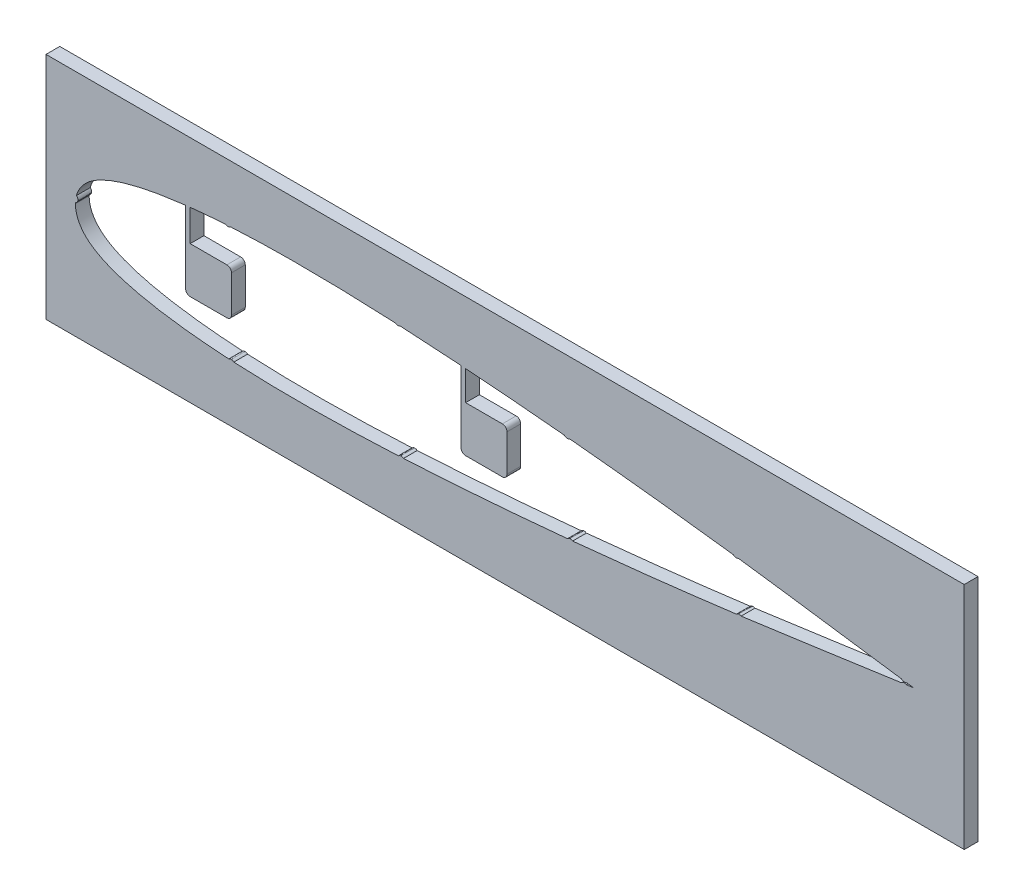
from build123d import *

# Parameters (mm, degrees)
BOSS_EXTRUDE1_OUTLINE_W = 200
BOSS_EXTRUDE1_OUTLINE_H = 50
BOSS_EXTRUDE1_DEPTH     = 3
BOSS_EXTRUDE2_DEPTH     = 3


# Read off the part's stored shape, not the designer's step: Boss-Extrude1
with BuildPart() as part:
    # Boss-Extrude1 outline → Boss-Extrude1 (new body)
    with BuildSketch(Plane.XY):
        with Locations((-60.40087472, 5.874355653)):
            Rectangle(BOSS_EXTRUDE1_OUTLINE_W, BOSS_EXTRUDE1_OUTLINE_H)
        with BuildLine():
            ThreePointArc((-120, 9.874355653), (-120.292893219, 10.581462434), (-121, 10.874355653))
            Line((-121, 10.874355653), (-129, 10.874355653))
            Line((-129, 10.874355653), (-129, 17.728224754))
            add(Edge.make_bspline(
                [(-70, 17.392393963), (-71.039460507, 17.46612011), (-76.013551912, 17.808647867), (-84.935836022, 18.330201475), (-96.791919459, 18.772019121), (-106.707243475, 18.86377853), (-114.665741331, 18.703361206), (-120.648326647, 18.441030965), (-125.42908199, 18.090687531), (-128.216637789, 17.81299496), (-129, 17.728224754)],
                knots=[0.15615159, 0.15615159, 0.15615159, 0.15615159, 0.17648551, 0.25342483, 0.33036415, 0.407303471, 0.445773131, 0.484242791, 0.522712451, 0.53773034, 0.53773034, 0.53773034, 0.53773034], degree=3))
            Line((-70, 17.392393963), (-70, 1.874355653))
            ThreePointArc((-70, 1.874355653), (-69.707106781, 1.167248872), (-69, 0.874355653))
            Line((-69, 0.874355653), (-61, 0.874355653))
            ThreePointArc((-61, 0.874355653), (-60.292893219, 1.167248872), (-60, 1.874355653))
            Line((-60, 1.874355653), (-60, 9.874355653))
            ThreePointArc((-60, 9.874355653), (-60.292893219, 10.581462434), (-61, 10.874355653))
            Line((-61, 10.874355653), (-69, 10.874355653))
            Line((-69, 10.874355653), (-69, 17.307613873))
            add(Edge.make_bspline(
                [(28.535733713, 5.874355653), (22.036609546, 6.792169486), (11.654693654, 8.25451331), (-2.616466314, 10.297391117), (-18.24914202, 12.355943472), (-33.883084779, 14.148766468), (-49.552712035, 15.707085748), (-59.952843917, 16.622838071), (-66.44019909, 17.123046064), (-69, 17.307613873)],
                knots=[0.544251644, 0.544251644, 0.544251644, 0.544251644, 0.673011622, 0.749950942, 0.826890262, 0.980768902, 1.057708222, 1.134647542, 1.184731638, 1.184731638, 1.184731638, 1.184731638], degree=3))
            add(Edge.make_bspline(
                [(-154.013562962, 5.874355653), (-154.012754023, 5.864441531), (-154.006887941, 5.792504528), (-153.995963231, 5.657906898), (-153.975774654, 5.427005754), (-153.93974977, 4.887084814), (-153.673105066, 3.743723501), (-153.279079305, 2.883810187), (-152.881070171, 2.211681144), (-152.43841655, 1.609129761), (-151.979085597, 1.087670791), (-151.364374578, 0.487793016), (-150.623077814, -0.110331018), (-149.465307138, -0.888819845), (-148.078733839, -1.627408488), (-146.46986192, -2.322062574), (-144.893878402, -2.893489486), (-143.338316404, -3.380138223), (-141.282202008, -3.943733592), (-138.735676538, -4.524887858), (-135.698358098, -5.085192271), (-131.665965724, -5.695115565), (-126.648395762, -6.252707907), (-120.64840496, -6.69241361), (-114.665815836, -6.954758154), (-106.70731247, -7.115194365), (-96.791980902, -7.023458271), (-84.93588765, -6.581668259), (-73.114551583, -5.89067806), (-61.322309402, -5.007072053), (-49.552951676, -3.969153072), (-33.883523656, -2.408714089), (-18.249811866, -0.613776043), (-2.617403057, 1.446891386), (11.653995311, 3.491772415), (22.036224825, 4.955590832), (28.535733713, 5.874355653)],
                knots=[-0.002136295, -0.002136295, -0.002136295, -0.002136295, -0.001943991, -0.000741814, 0.000460363, 0.002864716, 0.00526907, 0.007673424, 0.010077778, 0.012482131, 0.014886485, 0.017290839, 0.022099546, 0.026908254, 0.036525669, 0.046143084, 0.055760499, 0.065377914, 0.074995329, 0.094230159, 0.113464989, 0.132699819, 0.171169479, 0.209639139, 0.248108799, 0.286578459, 0.36351778, 0.4404571, 0.51739642, 0.59433574, 0.67127506, 0.74821438, 0.90209302, 0.979032341, 1.055971661, 1.184741624, 1.184741624, 1.184741624, 1.184741624], degree=3))
            add(Edge.make_bspline(
                [(-130, 17.616286621), (-130.890784829, 17.513197686), (-132.787760417, 17.274086814), (-135.698276658, 16.833877019), (-138.735597194, 16.273596559), (-141.282125283, 15.692462458), (-143.338242526, 15.128883439), (-144.893807145, 14.642247117), (-146.469793925, 14.07083284), (-148.078670038, 13.376191734), (-149.465248036, 12.637614381), (-150.62302389, 11.859135098), (-151.364324742, 11.261017247), (-151.979039955, 10.661144675), (-152.438374608, 10.139689647), (-152.88103257, 9.537142135), (-153.279046617, 8.865016669), (-153.67307875, 8.005107026), (-153.939732102, 6.861748632), (-153.97576114, 6.3218284), (-153.995951491, 6.090927588), (-154.006880595, 5.956288759), (-154.012750589, 5.884310868), (-154.013562962, 5.874355653)],
                knots=[-0.002137093, -0.002137093, -0.002137093, -0.002137093, 0.014926792, 0.034161622, 0.053396452, 0.072631282, 0.082248697, 0.091866112, 0.101483527, 0.111100942, 0.120718357, 0.125527064, 0.130335772, 0.132740126, 0.135144479, 0.137548833, 0.139953187, 0.142357541, 0.144761894, 0.147166248, 0.148368425, 0.149570602, 0.149763704, 0.149763704, 0.149763704, 0.149763704], degree=3))
            Line((-130, 17.616286621), (-130, 1.874355653))
            ThreePointArc((-130, 1.874355653), (-129.707106781, 1.167248872), (-129, 0.874355653))
            Line((-129, 0.874355653), (-121, 0.874355653))
            ThreePointArc((-121, 0.874355653), (-120.292893219, 1.167248872), (-120, 1.874355653))
            Line((-120, 1.874355653), (-120, 9.874355653))
        make_face(mode=Mode.SUBTRACT)
    extrude(amount=BOSS_EXTRUDE1_DEPTH)

    # Sketch3 → Boss-Extrude2 (add)
    with BuildSketch(Plane.XY.offset(3)):
        with BuildLine():
            add(Edge.make_bspline(
                [(26.671525209, 7.645516015), (26.616038617, 7.650569387), (26.507123633, 7.660488682), (26.345281059, 7.636193947), (26.191923314, 7.579809713), (26.052060712, 7.491194296), (25.928194971, 7.380786842), (25.830275983, 7.248850247), (25.760462874, 7.098320514), (25.739243735, 6.989196587), (25.728365772, 6.933254354)],
                knots=[0, 0, 0, 0, 1.01487162, 1.992097965, 2.960683225, 3.979797821, 4.998693386, 5.975234306, 6.962006619, 8, 8, 8, 8], degree=3))
            add(Edge.make_bspline(
                [(25.728365772, 6.933254354), (25.723331591, 6.877778616), (25.713449963, 6.768884935), (25.737609394, 6.605954364), (25.795818705, 6.451966665), (25.882541924, 6.309213074), (25.994360079, 6.186667304), (26.122576874, 6.085634112), (26.271561392, 6.017859814), (26.378256471, 5.995469978), (26.432634557, 5.984058802)],
                knots=[0, 0, 0, 0, 1.017250327, 1.996767144, 2.984718075, 4.014456741, 5.035740444, 6.007519375, 6.984514713, 8, 8, 8, 8], degree=3))
            add(Edge.make_bspline(
                [(26.432634557, 5.984058802), (26.488166585, 5.978760002), (26.597449139, 5.968332391), (26.759455372, 5.996378725), (26.91440604, 6.050305144), (27.0550898, 6.140075129), (27.178836377, 6.251279884), (27.274581921, 6.385125695), (27.344491203, 6.533760849), (27.36526677, 6.64165117), (27.375793993, 6.696320463)],
                knots=[0, 0, 0, 0, 1.015281961, 1.997993063, 2.976832369, 3.996359022, 5.026059393, 5.998794247, 6.98596554, 8, 8, 8, 8], degree=3))
            add(Edge.make_bspline(
                [(27.375793993, 6.696320463), (27.381247182, 6.753062322), (27.391889552, 6.863798979), (27.368606008, 7.028829905), (27.310408404, 7.182590437), (27.223877652, 7.324150189), (27.11315868, 7.447298389), (26.981882362, 7.544803299), (26.833398812, 7.614350404), (26.726182522, 7.634992813), (26.671525209, 7.645516015)],
                knots=[0, 0, 0, 0, 1.037794969, 2.025346855, 3.010187337, 4.019462608, 5.037530918, 6.013278971, 6.987198353, 8, 8, 8, 8], degree=3))
        make_face()
        with BuildLine():
            add(Edge.make_bspline(
                [(-9.997383847, 12.743905693), (-10.052966305, 12.74776428), (-10.162069467, 12.755338325), (-10.323351968, 12.72756769), (-10.475461299, 12.667897506), (-10.613385261, 12.576293901), (-10.734847278, 12.463247422), (-10.829905416, 12.329234947), (-10.896464207, 12.177238242), (-10.915330986, 12.067683106), (-10.925003014, 12.011519814)],
                knots=[0, 0, 0, 0, 1.01487162, 1.992097965, 2.960683225, 3.979797821, 4.998693386, 5.975234306, 6.962006619, 8, 8, 8, 8], degree=3))
            add(Edge.make_bspline(
                [(-10.925003014, 12.011519814), (-10.928842649, 11.955948619), (-10.936379493, 11.846867566), (-10.908720726, 11.68449441), (-10.847212335, 11.53179453), (-10.7574383, 11.390939544), (-10.643009844, 11.270827539), (-10.512649315, 11.172575899), (-10.362241326, 11.108022206), (-10.255089292, 11.087932753), (-10.200478315, 11.077693987)],
                knots=[0, 0, 0, 0, 1.017250327, 1.996767144, 2.984718075, 4.014456741, 5.035740444, 6.007519375, 6.984514713, 8, 8, 8, 8], degree=3))
            add(Edge.make_bspline(
                [(-10.200478315, 11.077693987), (-10.144845151, 11.073591005), (-10.035363569, 11.065516669), (-9.873998151, 11.097041557), (-9.720243393, 11.154288761), (-9.5815233, 11.247064331), (-9.460197571, 11.360905363), (-9.367353445, 11.496779858), (-9.300657747, 11.64688449), (-9.282207901, 11.755196764), (-9.272859147, 11.810079866)],
                knots=[0, 0, 0, 0, 1.015281961, 1.997993063, 2.976832369, 3.996359022, 5.026059393, 5.998794247, 6.98596554, 8, 8, 8, 8], degree=3))
            add(Edge.make_bspline(
                [(-9.272859147, 11.810079866), (-9.268627839, 11.866925902), (-9.260370074, 11.97786587), (-9.287198339, 12.142357737), (-9.348690139, 12.294830754), (-9.438246069, 12.434496317), (-9.551588557, 12.555234258), (-9.684932002, 12.649892618), (-9.834877274, 12.716229483), (-9.942512808, 12.734560703), (-9.997383847, 12.743905693)],
                knots=[0, 0, 0, 0, 1.037794969, 2.025346855, 3.010187337, 4.019462608, 5.037530918, 6.013278971, 6.987198353, 8, 8, 8, 8], degree=3))
        make_face()
        with BuildLine():
            add(Edge.make_bspline(
                [(-46.802773528, 16.883535289), (-46.858209225, 16.885056847), (-46.966766327, 16.888036441), (-47.125793078, 16.852475582), (-47.275865471, 16.789589084), (-47.408620348, 16.691576547), (-47.526778382, 16.575738138), (-47.614980862, 16.4373885), (-47.675870174, 16.283145863), (-47.689770224, 16.173294897), (-47.69692181, 16.116776498)],
                knots=[0, 0, 0, 0, 1.012917953, 1.983549283, 2.961176661, 3.974020675, 4.988932927, 5.977529819, 6.959437681, 8, 8, 8, 8], degree=3))
            add(Edge.make_bspline(
                [(-47.69692181, 16.116776498), (-47.699500597, 16.06080095), (-47.704527393, 15.951688532), (-47.667654807, 15.791718382), (-47.605809219, 15.64031551), (-47.508722014, 15.505497232), (-47.392552347, 15.387751432), (-47.255617989, 15.299991769), (-47.104971527, 15.236545824), (-46.996805385, 15.22339679), (-46.941525526, 15.216676787)],
                knots=[0, 0, 0, 0, 1.024721406, 1.99747629, 2.987400565, 4.010946832, 5.028079514, 6.007461816, 6.981684776, 8, 8, 8, 8], degree=3))
            add(Edge.make_bspline(
                [(-46.941525526, 15.216676787), (-46.88628185, 15.214528979), (-46.7773563, 15.210294082), (-46.6171004, 15.243941214), (-46.468685105, 15.31240487), (-46.332897907, 15.407299609), (-46.21591658, 15.52606637), (-46.12675531, 15.664265524), (-46.067006403, 15.817482816), (-46.051640808, 15.925683632), (-46.0438274, 15.980703773)],
                knots=[0, 0, 0, 0, 1.010507111, 1.992446048, 2.967035268, 3.988379424, 5.013529662, 6.002157841, 6.984096778, 8, 8, 8, 8], degree=3))
            add(Edge.make_bspline(
                [(-46.0438274, 15.980703773), (-46.042070909, 16.037401086), (-46.038651061, 16.147789524), (-46.072633806, 16.309858667), (-46.13984369, 16.458887811), (-46.23319649, 16.595164363), (-46.350055293, 16.711724324), (-46.48680422, 16.801034178), (-46.639582154, 16.860304247), (-46.747763359, 16.875704338), (-46.802773528, 16.883535289)],
                knots=[0, 0, 0, 0, 1.036127545, 2.017317846, 3.001172052, 4.012980307, 5.027150879, 6.003681006, 6.984871308, 8, 8, 8, 8], degree=3))
        make_face()
        with BuildLine():
            add(Edge.make_bspline(
                [(-83.712034068, 19.747277512), (-83.768093815, 19.748842259), (-83.87738257, 19.75189274), (-84.035945971, 19.711204852), (-84.185083737, 19.645535299), (-84.317429203, 19.545413069), (-84.432464247, 19.425729247), (-84.52059827, 19.287091401), (-84.578666205, 19.131468856), (-84.59016839, 19.021111945), (-84.596078204, 18.964410651)],
                knots=[0, 0, 0, 0, 1.019817041, 1.98813834, 2.961059037, 3.980219239, 4.997698922, 5.979678029, 6.961960169, 8, 8, 8, 8], degree=3))
            add(Edge.make_bspline(
                [(-84.596078204, 18.964410651), (-84.597544762, 18.908373452), (-84.600420409, 18.798494886), (-84.560707991, 18.639017447), (-84.49406222, 18.489022842), (-84.39470585, 18.355942904), (-84.277628088, 18.237491937), (-84.138856785, 18.150586464), (-83.985485956, 18.092801998), (-83.877282771, 18.079826633), (-83.821985646, 18.073195587)],
                knots=[0, 0, 0, 0, 1.021982574, 2.0039185, 2.978905148, 4.009334003, 5.026920303, 6.010984595, 6.98351574, 8, 8, 8, 8], degree=3))
            add(Edge.make_bspline(
                [(-83.821985646, 18.073195587), (-83.765923504, 18.072709968), (-83.656925414, 18.071765811), (-83.496722984, 18.108562599), (-83.347706514, 18.176762082), (-83.213766078, 18.276841366), (-83.099433306, 18.39784201), (-83.013236409, 18.537873382), (-82.955770908, 18.691767667), (-82.942626203, 18.800581704), (-82.935948355, 18.855862026)],
                knots=[0, 0, 0, 0, 1.022004452, 1.987018837, 2.977257147, 3.997072368, 5.024891971, 6.002104247, 6.985017706, 8, 8, 8, 8], degree=3))
            add(Edge.make_bspline(
                [(-82.935948355, 18.855862026), (-82.935251927, 18.912622136), (-82.933887399, 19.023833534), (-82.972803451, 19.185349942), (-83.03855564, 19.336067384), (-83.137019126, 19.469687592), (-83.256206829, 19.584576987), (-83.395592397, 19.669650695), (-83.54849422, 19.727760629), (-83.65672357, 19.740676745), (-83.712034068, 19.747277512)],
                knots=[0, 0, 0, 0, 1.033670977, 2.025295504, 3.009006503, 4.020254344, 5.03795921, 6.014759962, 6.985445137, 8, 8, 8, 8], degree=3))
        make_face()
        with BuildLine():
            add(Edge.make_bspline(
                [(-120.866940857, 19.893759858), (-120.922297952, 19.888330357), (-121.031029128, 19.877665851), (-121.185377522, 19.821155235), (-121.324629535, 19.735142533), (-121.445637882, 19.621127924), (-121.546725035, 19.489357418), (-121.616071874, 19.339225492), (-121.655460423, 19.177548011), (-121.65496773, 19.065735855), (-121.654716857, 19.0088026)],
                knots=[0, 0, 0, 0, 1.009964173, 1.983749174, 2.963367315, 3.973111684, 4.997045194, 5.969309367, 6.965999486, 8, 8, 8, 8], degree=3))
            add(Edge.make_bspline(
                [(-121.654716857, 19.0088026), (-121.648375267, 18.953575516), (-121.635847051, 18.844470877), (-121.58054595, 18.689059037), (-121.493269035, 18.549105451), (-121.380411035, 18.427181997), (-121.249660262, 18.324390645), (-121.100710202, 18.256686171), (-120.942197618, 18.21565032), (-120.832896713, 18.215958145), (-120.777251689, 18.216114858)],
                knots=[0, 0, 0, 0, 1.01458904, 2.004385593, 2.988132912, 4.012019221, 5.031450495, 6.007812848, 6.985778738, 8, 8, 8, 8], degree=3))
            add(Edge.make_bspline(
                [(-120.777251689, 18.216114858), (-120.721790019, 18.221284114), (-120.612699281, 18.23145182), (-120.459982956, 18.291716016), (-120.31825591, 18.374704395), (-120.196795136, 18.490001733), (-120.098581673, 18.62494142), (-120.028972544, 18.773976093), (-119.988633127, 18.933504366), (-119.990359204, 19.043314535), (-119.991232141, 19.098849385)],
                knots=[0, 0, 0, 0, 1.012746444, 1.992029068, 2.969258287, 3.998834602, 5.02616838, 6.001110967, 6.989091773, 8, 8, 8, 8], degree=3))
            add(Edge.make_bspline(
                [(-119.991232141, 19.098849385), (-119.996720236, 19.155569973), (-120.007438307, 19.266343457), (-120.064995426, 19.422584911), (-120.147871435, 19.564816399), (-120.262293518, 19.685900768), (-120.395587183, 19.784204068), (-120.542625473, 19.856376299), (-120.702475628, 19.893405813), (-120.811380281, 19.893640253), (-120.866940857, 19.893759858)],
                knots=[0, 0, 0, 0, 1.035677954, 2.022645755, 3.009613556, 4.020716163, 5.037671801, 6.017699663, 6.988677293, 8, 8, 8, 8], degree=3))
        make_face()
        with BuildLine():
            add(Edge.make_bspline(
                [(-155.117511996, 7.05504211), (-155.124535032, 6.999759288), (-155.13827439, 6.891607992), (-155.121106236, 6.7290156), (-155.070822335, 6.574121928), (-154.9893637, 6.430218759), (-154.881896475, 6.30368828), (-154.755003874, 6.199313206), (-154.607020847, 6.124461021), (-154.499642476, 6.09916469), (-154.444656152, 6.086210942)],
                knots=[0, 0, 0, 0, 1.017350342, 1.990270291, 2.963727447, 3.97931436, 4.996664702, 5.986102446, 6.968723191, 8, 8, 8, 8], degree=3))
            add(Edge.make_bspline(
                [(-154.444656152, 6.086210942), (-154.389620308, 6.078326293), (-154.280888049, 6.062748887), (-154.117621464, 6.082041059), (-153.961554191, 6.132472558), (-153.817038919, 6.212843497), (-153.688138386, 6.316978937), (-153.585467579, 6.443279366), (-153.508110098, 6.587798559), (-153.483709446, 6.694231372), (-153.471218998, 6.748713261)],
                knots=[0, 0, 0, 0, 1.016375712, 2.008015472, 2.983713517, 4.009494872, 5.024467005, 6.004538507, 6.978543298, 8, 8, 8, 8], degree=3))
            add(Edge.make_bspline(
                [(-153.471218998, 6.748713261), (-153.463196075, 6.803768186), (-153.447431366, 6.911948822), (-153.468403788, 7.074337725), (-153.517499685, 7.230335972), (-153.601358794, 7.373657979), (-153.708296459, 7.500179791), (-153.834136114, 7.605029425), (-153.981204662, 7.67850932), (-154.087432821, 7.705143343), (-154.14148646, 7.718695926)],
                knots=[0, 0, 0, 0, 1.01571244, 1.995832675, 2.970893993, 3.997612812, 5.016639648, 5.99607157, 6.980311577, 8, 8, 8, 8], degree=3))
            add(Edge.make_bspline(
                [(-154.14148646, 7.718695926), (-154.197381951, 7.725952579), (-154.306714331, 7.740146698), (-154.471162196, 7.72377642), (-154.627807461, 7.674135604), (-154.773736896, 7.594111348), (-154.899597998, 7.486142059), (-155.004145699, 7.361086803), (-155.077583847, 7.214711582), (-155.103992112, 7.109107044), (-155.117511996, 7.05504211)],
                knots=[0, 0, 0, 0, 1.02871531, 2.01218185, 2.994813304, 4.017854305, 5.03482249, 6.01227575, 6.982371565, 8, 8, 8, 8], degree=3))
        make_face()
        with BuildLine():
            add(Edge.make_bspline(
                [(-120.131260617, -8.167997006), (-120.186525487, -8.162408056), (-120.295801819, -8.151356913), (-120.449466767, -8.092618398), (-120.589288509, -8.006800689), (-120.709673812, -7.89306332), (-120.808719106, -7.759143371), (-120.877439263, -7.609216777), (-120.915755435, -7.446749323), (-120.91360945, -7.335525241), (-120.912510617, -7.278573929)],
                knots=[0, 0, 0, 0, 1.007931548, 1.993003185, 2.965074996, 3.980463599, 4.99000819, 5.980470956, 6.965917931, 8, 8, 8, 8], degree=3))
            add(Edge.make_bspline(
                [(-120.912510617, -7.278573929), (-120.906923169, -7.223307572), (-120.895874996, -7.114028302), (-120.837114691, -6.960384916), (-120.751379538, -6.820481478), (-120.637046711, -6.700123716), (-120.504194187, -6.599925736), (-120.356319117, -6.527815524), (-120.195856315, -6.49084141), (-120.086689261, -6.491154755), (-120.03110036, -6.491314313)],
                knots=[0, 0, 0, 0, 1.012287025, 2.001615357, 2.977887688, 3.997663991, 5.018829288, 6.00770508, 6.985504507, 8, 8, 8, 8], degree=3))
            add(Edge.make_bspline(
                [(-120.03110036, -6.491314313), (-119.97585016, -6.496928495), (-119.866602835, -6.508029529), (-119.713260955, -6.566198673), (-119.574258004, -6.653193918), (-119.454423082, -6.76827516), (-119.357417746, -6.903112163), (-119.285822463, -7.050946043), (-119.249556087, -7.211365773), (-119.249751464, -7.321156572), (-119.24985036, -7.37673098)],
                knots=[0, 0, 0, 0, 1.012760298, 2.002551171, 2.968904037, 3.997539403, 5.02180996, 5.994862194, 6.985030201, 8, 8, 8, 8], degree=3))
            add(Edge.make_bspline(
                [(-119.24985036, -7.37673098), (-119.256457081, -7.433214849), (-119.269405988, -7.543920953), (-119.324237098, -7.701894862), (-119.412951271, -7.841810566), (-119.526584894, -7.963365007), (-119.659989356, -8.060950564), (-119.806947573, -8.131564187), (-119.966496939, -8.168504826), (-120.07566911, -8.168168345), (-120.131260617, -8.167997006)],
                knots=[0, 0, 0, 0, 1.034819665, 2.028204768, 3.018002552, 4.034396654, 5.044940958, 6.014312746, 6.988869193, 8, 8, 8, 8], degree=3))
        make_face()
        with BuildLine():
            add(Edge.make_bspline(
                [(-83.040979984, -7.902476043), (-83.096681738, -7.902289035), (-83.205711403, -7.901922988), (-83.363606948, -7.858773968), (-83.510747061, -7.788211072), (-83.641090012, -7.685911045), (-83.751684616, -7.562068978), (-83.835693867, -7.420357245), (-83.886853219, -7.262019175), (-83.897112247, -7.151631156), (-83.902358189, -7.095184377)],
                knots=[0, 0, 0, 0, 1.013689814, 1.984179198, 2.960782924, 3.978282514, 4.989326382, 5.978948029, 6.96653752, 8, 8, 8, 8], degree=3))
            add(Edge.make_bspline(
                [(-83.902358189, -7.095184377), (-83.901252337, -7.039508041), (-83.899075574, -6.92991449), (-83.857185464, -6.771118682), (-83.786083107, -6.623357256), (-83.683265738, -6.492980976), (-83.560406434, -6.381084038), (-83.421016975, -6.295179565), (-83.265754833, -6.240491538), (-83.15693575, -6.230779029), (-83.101076138, -6.225793351)],
                knots=[0, 0, 0, 0, 1.016249921, 2.000390955, 2.978823687, 3.998228874, 5.019317759, 6.006565378, 6.976719151, 8, 8, 8, 8], degree=3))
            add(Edge.make_bspline(
                [(-83.101076138, -6.225793351), (-83.045429392, -6.226967151), (-82.935894084, -6.229277665), (-82.776967432, -6.270115103), (-82.630689429, -6.344890549), (-82.501720923, -6.449003371), (-82.388225412, -6.570503355), (-82.307523181, -6.712921346), (-82.251957321, -6.867552078), (-82.243838478, -6.977177116), (-82.239697933, -7.033085018)],
                knots=[0, 0, 0, 0, 1.01630795, 2.00050518, 2.973481989, 4.000464354, 5.021611544, 5.99642908, 6.978194689, 8, 8, 8, 8], degree=3))
            add(Edge.make_bspline(
                [(-82.239697933, -7.033085018), (-82.240676548, -7.090118823), (-82.242580639, -7.201089386), (-82.285316876, -7.361615206), (-82.355417905, -7.510485495), (-82.458276323, -7.64123425), (-82.581808812, -7.751218773), (-82.72117827, -7.83534903), (-82.876673836, -7.887272887), (-82.985173964, -7.897312343), (-83.040979984, -7.902476043)],
                knots=[0, 0, 0, 0, 1.038440826, 2.020492305, 3.007830572, 4.025071329, 5.035858006, 6.014723707, 6.978891809, 8, 8, 8, 8], degree=3))
        make_face()
        with BuildLine():
            add(Edge.make_bspline(
                [(-46.125707517, -5.086557552), (-46.181241537, -5.088020541), (-46.290702516, -5.090904183), (-46.451547956, -5.058260102), (-46.601539282, -4.991489953), (-46.737921827, -4.896684928), (-46.853966526, -4.77659958), (-46.944102671, -4.638333398), (-47.004455099, -4.482603075), (-47.018144925, -4.371928404), (-47.02514662, -4.315323578)],
                knots=[0, 0, 0, 0, 1.008705381, 1.988220537, 2.956819845, 3.97825502, 4.992362785, 5.976615557, 6.965135178, 8, 8, 8, 8], degree=3))
            add(Edge.make_bspline(
                [(-47.02514662, -4.315323578), (-47.027875547, -4.259021781), (-47.033197964, -4.149212451), (-46.994734013, -3.98923258), (-46.933546464, -3.837247368), (-46.836328997, -3.701214069), (-46.718284381, -3.583432538), (-46.58052777, -3.493465218), (-46.428360488, -3.430282406), (-46.319273535, -3.416743682), (-46.263928671, -3.40987486)],
                knots=[0, 0, 0, 0, 1.02379044, 1.996770059, 2.974622982, 3.999066142, 5.024668667, 6.001609697, 6.986124027, 8, 8, 8, 8], degree=3))
            add(Edge.make_bspline(
                [(-46.263928671, -3.40987486), (-46.208332306, -3.408167608), (-46.098611505, -3.404798304), (-45.93853335, -3.441042134), (-45.787538362, -3.505791936), (-45.654224464, -3.605419084), (-45.535417313, -3.72286933), (-45.446047561, -3.861774327), (-45.385822354, -4.015281283), (-45.370357855, -4.123845834), (-45.362486363, -4.179105629)],
                knots=[0, 0, 0, 0, 1.011882911, 1.99697593, 2.96862643, 3.990374474, 5.016186882, 6.003540155, 6.983793879, 8, 8, 8, 8], degree=3))
            add(Edge.make_bspline(
                [(-45.362486363, -4.179105629), (-45.361029686, -4.235958098), (-45.358174964, -4.347374669), (-45.390313932, -4.511354278), (-45.459415455, -4.662106276), (-45.554260977, -4.798709072), (-45.672295166, -4.915342031), (-45.808632849, -5.005467673), (-45.96175997, -5.065586541), (-46.070443804, -5.079488609), (-46.125707517, -5.086557552)],
                knots=[0, 0, 0, 0, 1.033259584, 2.024929458, 3.009797009, 4.031480901, 5.037131669, 6.011441376, 6.988854832, 8, 8, 8, 8], degree=3))
        make_face()
        with BuildLine():
            add(Edge.make_bspline(
                [(-9.307051299, -0.944767721), (-9.362535055, -0.950049459), (-9.47147685, -0.960420099), (-9.631955956, -0.93102295), (-9.785265504, -0.876786944), (-9.92461071, -0.78860509), (-10.047920655, -0.676737957), (-10.14440323, -0.543747427), (-10.21417993, -0.392619768), (-10.234223967, -0.283725905), (-10.244551299, -0.227620285)],
                knots=[0, 0, 0, 0, 1.014709032, 1.992370952, 2.954272398, 3.974258012, 4.985434026, 5.981978762, 6.960250577, 8, 8, 8, 8], degree=3))
            add(Edge.make_bspline(
                [(-10.244551299, -0.227620285), (-10.249684135, -0.171486145), (-10.259694127, -0.062014046), (-10.232723407, 0.100539236), (-10.17954392, 0.255715589), (-10.089737323, 0.396060604), (-9.979423653, 0.520598967), (-9.847616467, 0.617699194), (-9.699068928, 0.68717744), (-9.592179663, 0.707487576), (-9.537419889, 0.717892535)],
                knots=[0, 0, 0, 0, 1.027222063, 2.003275654, 2.98845855, 4.008757816, 5.029276414, 6.016275038, 6.983730223, 8, 8, 8, 8], degree=3))
            add(Edge.make_bspline(
                [(-9.537419889, 0.717892535), (-9.482015457, 0.722791038), (-9.372674333, 0.732458275), (-9.210035354, 0.708169184), (-9.057581251, 0.646876819), (-8.917308842, 0.557482148), (-8.794675673, 0.444778458), (-8.694224679, 0.314057266), (-8.627593062, 0.163224814), (-8.60656612, 0.055380858), (-8.595913479, 0.0007451)],
                knots=[0, 0, 0, 0, 1.01341069, 1.999974739, 2.969276671, 3.994433847, 5.021547779, 5.997196831, 6.985342576, 8, 8, 8, 8], degree=3))
            add(Edge.make_bspline(
                [(-8.595913479, 0.0007451), (-8.590883061, -0.056019792), (-8.581070456, -0.166748441), (-8.606449169, -0.330755891), (-8.664157439, -0.484512319), (-8.751818652, -0.624978523), (-8.863870025, -0.747380588), (-8.995135282, -0.845258368), (-9.144967048, -0.913606205), (-9.25234682, -0.934250508), (-9.307051299, -0.944767721)],
                knots=[0, 0, 0, 0, 1.036951729, 2.022733792, 2.998294729, 4.016167807, 5.025249532, 6.009901154, 6.986146829, 8, 8, 8, 8], degree=3))
        make_face()
        with BuildLine():
            add(Edge.make_bspline(
                [(26.662736918, 4.11153514), (26.607253162, 4.106253402), (26.498311367, 4.095882762), (26.337832261, 4.125279911), (26.184522713, 4.179515917), (26.045177508, 4.267697771), (25.921867562, 4.379564904), (25.825384987, 4.512555434), (25.755608288, 4.663683093), (25.735564251, 4.772576957), (25.725236918, 4.828682576)],
                knots=[0, 0, 0, 0, 1.014709032, 1.992370952, 2.954272398, 3.974258012, 4.985434026, 5.981978762, 6.960250577, 8, 8, 8, 8], degree=3))
            add(Edge.make_bspline(
                [(25.725236918, 4.828682576), (25.720104082, 4.884816716), (25.71009409, 4.994288816), (25.737064811, 5.156842097), (25.790244298, 5.31201845), (25.880050894, 5.452363465), (25.990364565, 5.576901828), (26.12217175, 5.674002055), (26.270719289, 5.743480301), (26.377608555, 5.763790437), (26.432368328, 5.774195397)],
                knots=[0, 0, 0, 0, 1.027222063, 2.003275654, 2.98845855, 4.008757816, 5.029276414, 6.016275038, 6.983730223, 8, 8, 8, 8], degree=3))
            add(Edge.make_bspline(
                [(26.432368328, 5.774195397), (26.48777276, 5.779093899), (26.597113884, 5.788761137), (26.759752863, 5.764472045), (26.912206966, 5.70317968), (27.052479376, 5.613785009), (27.175112545, 5.50108132), (27.275563539, 5.370360127), (27.342195155, 5.219527675), (27.363222098, 5.111683719), (27.373874739, 5.057047961)],
                knots=[0, 0, 0, 0, 1.01341069, 1.999974739, 2.969276671, 3.994433847, 5.021547779, 5.997196831, 6.985342576, 8, 8, 8, 8], degree=3))
            add(Edge.make_bspline(
                [(27.373874739, 5.057047961), (27.378905157, 5.000283069), (27.388717761, 4.88955442), (27.363339049, 4.72554697), (27.305630779, 4.571790542), (27.217969565, 4.431324339), (27.105918193, 4.308922273), (26.974652936, 4.211044493), (26.824821169, 4.142696656), (26.717441398, 4.122052353), (26.662736918, 4.11153514)],
                knots=[0, 0, 0, 0, 1.036951729, 2.022733792, 2.998294729, 4.016167807, 5.025249532, 6.009901154, 6.986146829, 8, 8, 8, 8], degree=3))
        make_face()
    extrude(amount=-BOSS_EXTRUDE2_DEPTH)


solid = part.part
